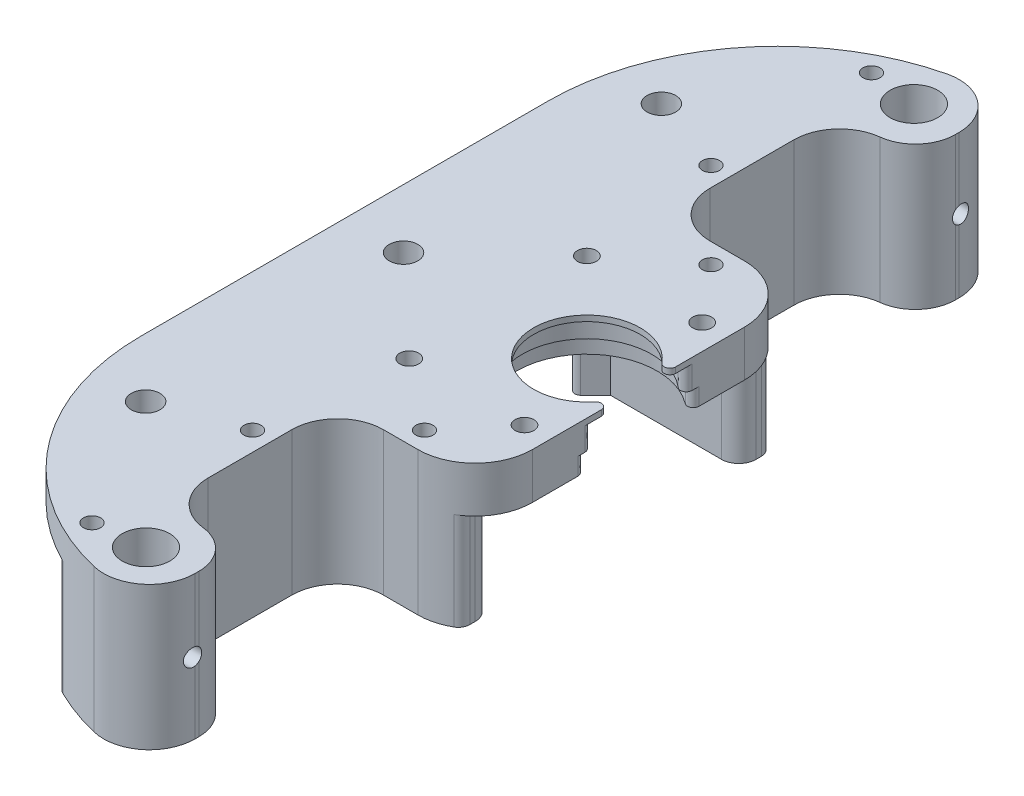
from build123d import *

# Parameters (mm, degrees)
SZKIC2_R                        = 1.65
SZKIC2_R_2                      = 11.3
SZKIC2_W                        = 13.3
SZKIC2_H                        = 7
SZKIC2_R_3                      = 1.5
SZKIC2_W_2                      = 6.7
SZKIC2_R_4                      = 4.15
SZKIC2_R_5                      = 2.5
DODANIE_WYCI_GNI_CIE1_DEPTH     = 5
DODANIE_WYCI_GNI_CIE2_START     = -20
SZKIC2_3_R                      = 1.5
DODANIE_WYCI_GNI_CIE2_DEPTH     = 20
ZAOKR_GLENIE1_R                 = 7
SZKIC3_R                        = 4.15
DODANIE_WYCI_GNI_CIE3_DEPTH     = 20
ZAOKR_GLENIE2_R                 = 3
ZAOKR_GLENIE3_R                 = 10
WYTNIJ_WYCI_GNI_CIE1_DEPTH      = 146.394986561
ZAOKR_GLENIE4_R                 = 15
ZAOKR_GLENIE5_R                 = 1
ZAOKR_GLENIE6_R                 = 40
ZAOKR_GLENIE7_R                 = 3
ZAOKR_GLENIE10_R                = 8
ZAOKR_GLENIE11_R                = 8
DODANIE_WYCI_GNI_CIE4_START     = -1
SZKIC6_R                        = 11.3
SZKIC6_R_2                      = 9.3
DODANIE_WYCI_GNI_CIE4_DEPTH     = 1
SZKIC7_R                        = 12.25
SZKIC7_R_2                      = 1.65
DODANIE_WYCI_GNI_CIE5_DEPTH     = 3
WYTNIJ_WYCI_GNI_CIE4_REACH      = 120.613
WYTNIJ_WYCI_GNI_CIE4_END_RADIUS = 4.15
SZKIC9_R                        = 1.5
WYTNIJ_WYCI_GNI_CIE5_REACH      = 120.613
WYTNIJ_WYCI_GNI_CIE5_END_RADIUS = 4.15
SZKIC9_3_R                      = 1.5
SZKIC10_W                       = 38.080641696
SZKIC10_H                       = 104.696958421
WYTNIJ_WYCI_GNI_CIE6_DEPTH      = 146.901949605
ZAOKR_GLENIE12_R                = 1
ZAOKR_GLENIE13_R                = 1
ZAOKR_GLENIE14_R                = 10
ZAOKR_GLENIE15_R                = 2


with BuildPart() as part:
    # Szkic2 → Dodanie-wyciągnięcie1 (new body)
    # profile 1 of 14: a face of its own
    with BuildSketch(Plane(origin=(0, 0, 0), x_dir=(1, 0, 0), z_dir=(0, 1, 0))):
        Polygon((-68.051313495, 13.491175162), (-65.66044053, 13.491175162), (-52.36044053, 13.491175162), (-45.66044053, 13.491175162), (-33.269567565, 13.491175162), (-29.16044053, 13.491175162), (-29.16044053, 17.600302197), (-29.16044053, 52.382048128), (-29.16044053, 56.491175162), (-33.269567565, 56.491175162), (-45.66044053, 56.491175162), (-52.36044053, 56.491175162), (-65.66044053, 56.491175162), (-68.051313495, 56.491175162), (-72.36044053, 52.182048128), (-72.36044053, 17.800302197), align=None)
        with Locations(Location((-66.16044053, 19.491175162, 0), (0, 0, 270))):
            Circle(SZKIC2_R, mode=Mode.SUBTRACT)
        with Locations(Location((-46.051180357, 19.491175162, 0), (0, 0, 270))):
            Circle(SZKIC2_R, mode=Mode.SUBTRACT)
        with Locations(Location((-50.66044053, 34.991175162, 0), (0, 0, 270))):
            Circle(SZKIC2_R_2, mode=Mode.SUBTRACT)
        with Locations(Location((-35.16044053, 19.491175162, 0), (0, 0, 270))):
            Circle(SZKIC2_R, mode=Mode.SUBTRACT)
        with Locations(Location((-66.16044053, 50.491175162, 0), (0, 0, 270))):
            Circle(SZKIC2_R, mode=Mode.SUBTRACT)
        with Locations(Location((-46.051180357, 50.491175162, 0), (0, 0, 270))):
            Circle(SZKIC2_R, mode=Mode.SUBTRACT)
        with Locations(Location((-35.16044053, 50.491175162, 0), (0, 0, 270))):
            Circle(SZKIC2_R, mode=Mode.SUBTRACT)
    # profile 2 of 14: a face of its own
    with BuildSketch(Plane(origin=(0, 0, 0), x_dir=(1, 0, 0), z_dir=(0, 1, 0))):
        with Locations((-59.01044053, 9.991175162)):
            Rectangle(SZKIC2_W, SZKIC2_H)
        with Locations(Location((-54.01044053, 9.991175162, 0), (0, 0, 270))):
            Circle(SZKIC2_R_3, mode=Mode.SUBTRACT)
    # profile 3 of 14: a face of its own
    with BuildSketch(Plane(origin=(0, 0, 0), x_dir=(1, 0, 0), z_dir=(0, 1, 0))):
        Polygon((-65.66044053, 6.491175162), (-65.66044053, 13.491175162), (-68.051313495, 13.491175162), (-72.36044053, 17.800302197), (-72.36044053, -11.508824838), (-72.36044053, -40.008824838), (-65.66044053, -40.008824838), (-65.66044053, -11.508824838), align=None)
        with Locations(Location((-69.01044053, -33.008824838, 0), (0, 0, 270))):
            Circle(SZKIC2_R_3, mode=Mode.SUBTRACT)
        with Locations(Location((-69.01044053, -5.008824838, 0), (0, 0, 270))):
            Circle(SZKIC2_R_3, mode=Mode.SUBTRACT)
    # profile 4 of 14: a face of its own
    with BuildSketch(Plane(origin=(0, 0, 0), x_dir=(1, 0, 0), z_dir=(0, 1, 0))):
        with Locations((-49.01044053, 9.991175162)):
            Rectangle(SZKIC2_W_2, SZKIC2_H)
    # profile 5 of 14: a face of its own
    with BuildSketch(Plane(origin=(0, 0, 0), x_dir=(1, 0, 0), z_dir=(0, 1, 0))):
        Polygon((-52.36044053, 6.491175162), (-65.66044053, 6.491175162), (-65.66044053, -11.508824838), (-52.36044053, -1.243587456), align=None)
    # profile 6 of 14: a face of its own
    with BuildSketch(Plane(origin=(0, 0, 0), x_dir=(1, 0, 0), z_dir=(0, 1, 0))):
        Polygon((-33.269567565, 13.491175162), (-45.66044053, 13.491175162), (-45.66044053, 6.491175162), (-52.36044053, 6.491175162), (-52.36044053, -1.243587456), align=None)
    # profile 7 of 14: a face of its own
    with BuildSketch(Plane(origin=(0, 0, 0), x_dir=(1, 0, 0), z_dir=(0, 1, 0))):
        Polygon((-52.36044053, -1.243587456), (-65.66044053, -11.508824838), (-65.66044053, -40.008824838), (-52.36044053, -40.008824838), align=None)
        with Locations(Location((-60.594472333, -32.008824838, 0), (0, 0, 270))):
            Circle(SZKIC2_R_4, mode=Mode.SUBTRACT)
    # profile 8 of 14: a face of its own
    with BuildSketch(Plane(origin=(0, 0, 0), x_dir=(1, 0, 0), z_dir=(0, 1, 0))):
        Polygon((-72.36044053, -11.508824838), (-72.36044053, 17.800302197), (-72.36044053, 52.182048128), (-72.36044053, 81.491175162), (-72.36044053, 109.991175162), (-92.96044053, 109.991175162), (-92.96044053, 81.491175162), (-92.96044053, -11.508824838), (-92.96044053, -40.008824838), (-72.36044053, -40.008824838), align=None)
        with Locations(Location((-82.66044053, -10.008824838, 0), (0, 0, 270))):
            Circle(SZKIC2_R_5, mode=Mode.SUBTRACT)
        with Locations(Location((-82.66044053, 34.991175162, 0), (0, 0, 270))):
            Circle(SZKIC2_R_5, mode=Mode.SUBTRACT)
        with Locations(Location((-82.66044053, 79.991175162, 0), (0, 0, 270))):
            Circle(SZKIC2_R_5, mode=Mode.SUBTRACT)
    # profile 9 of 14: a face of its own
    with BuildSketch(Plane(origin=(0, 0, 0), x_dir=(1, 0, 0), z_dir=(0, 1, 0))):
        Polygon((-72.36044053, 81.491175162), (-72.36044053, 52.182048128), (-68.051313495, 56.491175162), (-65.66044053, 56.491175162), (-65.66044053, 63.491175162), (-65.66044053, 81.491175162), (-65.66044053, 109.991175162), (-72.36044053, 109.991175162), align=None)
        with Locations(Location((-69.01044053, 74.991175162, 0), (0, 0, 270))):
            Circle(SZKIC2_R_3, mode=Mode.SUBTRACT)
        with Locations(Location((-69.01044053, 102.991175162, 0), (0, 0, 270))):
            Circle(SZKIC2_R_3, mode=Mode.SUBTRACT)
    # profile 10 of 14: a face of its own
    with BuildSketch(Plane(origin=(0, 0, 0), x_dir=(1, 0, 0), z_dir=(0, 1, 0))):
        with Locations((-59.01044053, 59.991175162)):
            Rectangle(SZKIC2_W, SZKIC2_H)
        with Locations(Location((-54.01044053, 59.991175162, 0), (0, 0, 270))):
            Circle(SZKIC2_R_3, mode=Mode.SUBTRACT)
    # profile 11 of 14: a face of its own
    with BuildSketch(Plane(origin=(0, 0, 0), x_dir=(1, 0, 0), z_dir=(0, 1, 0))):
        with Locations((-49.01044053, 59.991175162)):
            Rectangle(SZKIC2_W_2, SZKIC2_H)
    # profile 12 of 14: a face of its own
    with BuildSketch(Plane(origin=(0, 0, 0), x_dir=(1, 0, 0), z_dir=(0, 1, 0))):
        Polygon((-65.66044053, 81.491175162), (-65.66044053, 63.491175162), (-52.36044053, 63.491175162), (-52.36044053, 71.22593778), align=None)
    # profile 13 of 14: a face of its own
    with BuildSketch(Plane(origin=(0, 0, 0), x_dir=(1, 0, 0), z_dir=(0, 1, 0))):
        Polygon((-52.36044053, 109.991175162), (-65.66044053, 109.991175162), (-65.66044053, 81.491175162), (-52.36044053, 71.22593778), align=None)
        with Locations(Location((-60.594472333, 101.991175162, 0), (0, 0, 270))):
            Circle(SZKIC2_R_4, mode=Mode.SUBTRACT)
    # profile 14 of 14: a face of its own
    with BuildSketch(Plane(origin=(0, 0, 0), x_dir=(1, 0, 0), z_dir=(0, 1, 0))):
        Polygon((-45.66044053, 63.491175162), (-45.66044053, 56.491175162), (-33.269567565, 56.491175162), (-52.36044053, 71.22593778), (-52.36044053, 63.491175162), align=None)
    extrude(amount=DODANIE_WYCI_GNI_CIE1_DEPTH)

    # Szkic2<3> → Dodanie-wyciągnięcie2 (add)
    # profile 1 of 2: a face of its own
    with BuildSketch(Plane(origin=(0, 0, 0), x_dir=(1, 0, 0), z_dir=(0, 1, 0)).offset(DODANIE_WYCI_GNI_CIE2_START)):
        Polygon((-68.051313495, 13.491175162), (-72.36044053, 17.800302197), (-72.36044053, -40.008824838), (-65.66044053, -40.008824838), (-65.66044053, 6.491175162), (-45.66044053, 6.491175162), (-45.66044053, 13.491175162), align=None)
        with Locations(Location((-54.01044053, 9.991175162, 0), (0, 0, 270))):
            Circle(SZKIC2_3_R, mode=Mode.SUBTRACT)
        with Locations(Location((-69.01044053, -5.008824838, 0), (0, 0, 270))):
            Circle(SZKIC2_3_R, mode=Mode.SUBTRACT)
        with Locations(Location((-69.01044053, -33.008824838, 0), (0, 0, 270))):
            Circle(SZKIC2_3_R, mode=Mode.SUBTRACT)
    # profile 2 of 2: a face of its own
    with BuildSketch(Plane(origin=(0, 0, 0), x_dir=(1, 0, 0), z_dir=(0, 1, 0)).offset(DODANIE_WYCI_GNI_CIE2_START)):
        Polygon((-72.36044053, 109.991175162), (-72.36044053, 52.182048128), (-68.051313495, 56.491175162), (-45.66044053, 56.491175162), (-45.66044053, 63.491175162), (-65.66044053, 63.491175162), (-65.66044053, 109.991175162), align=None)
        with Locations(Location((-69.01044053, 74.991175162, 0), (0, 0, 270))):
            Circle(SZKIC2_3_R, mode=Mode.SUBTRACT)
        with Locations(Location((-69.01044053, 102.991175162, 0), (0, 0, 270))):
            Circle(SZKIC2_3_R, mode=Mode.SUBTRACT)
        with Locations(Location((-54.01044053, 59.991175162, 0), (0, 0, 270))):
            Circle(SZKIC2_3_R, mode=Mode.SUBTRACT)
    extrude(amount=DODANIE_WYCI_GNI_CIE2_DEPTH)

    # Zaokrąglenie1
    zaokr_glenie1_edges = [part.edges().sort_by_distance(p)[0] for p in [
        (-52.36044053, 2.5, 40.008824838),
        (-52.36044053, 2.5, -109.991175162),
    ]]
    fillet(zaokr_glenie1_edges, radius=ZAOKR_GLENIE1_R)

    # Szkic3 → Dodanie-wyciągnięcie3 (add)
    # profile 1 of 2: a face of its own
    with BuildSketch(Plane.XZ):
        with BuildLine():
            Line((-65.66044053, -109.991175162), (-59.36044053, -109.991175162))
            ThreePointArc((-59.36044053, -109.991175162), (-54.410693062, -107.940922631), (-52.36044053, -102.991175162))
            Line((-52.36044053, -102.991175162), (-52.36044053, -100.991175162))
            ThreePointArc((-52.36044053, -100.991175162), (-54.410693062, -96.041427694), (-59.36044053, -93.991175162))
            Line((-59.36044053, -93.991175162), (-65.66044053, -93.991175162))
            Line((-65.66044053, -93.991175162), (-65.66044053, -109.991175162))
        make_face()
        with Locations(Location((-60.594472333, -101.991175162, 0), (0, 0, 90))):
            Circle(SZKIC3_R, mode=Mode.SUBTRACT)
    # profile 2 of 2: a face of its own
    with BuildSketch(Plane.XZ):
        with BuildLine():
            Line((-65.66044053, 40.008824838), (-59.36044053, 40.008824838))
            ThreePointArc((-59.36044053, 40.008824838), (-54.410693062, 37.958572306), (-52.36044053, 33.008824838))
            Line((-52.36044053, 33.008824838), (-52.36044053, 31.008824838))
            ThreePointArc((-52.36044053, 31.008824838), (-54.410693062, 26.059077369), (-59.36044053, 24.008824838))
            Line((-59.36044053, 24.008824838), (-65.66044053, 24.008824838))
            Line((-65.66044053, 24.008824838), (-65.66044053, 40.008824838))
        make_face()
        with Locations(Location((-60.594472333, 32.008824838, 0), (0, 0, 90))):
            Circle(SZKIC3_R, mode=Mode.SUBTRACT)
    extrude(amount=DODANIE_WYCI_GNI_CIE3_DEPTH)

    # Zaokrąglenie2
    zaokr_glenie2_edges = [part.edges().sort_by_distance(p)[0] for p in [
        (-45.66044053, -10, -63.491175162),
        (-45.66044053, -10, -56.491175162),
        (-45.66044053, -10, -13.491175162),
        (-45.66044053, -10, -6.491175162),
    ]]
    fillet(zaokr_glenie2_edges, radius=ZAOKR_GLENIE2_R)

    # Zaokrąglenie3
    zaokr_glenie3_edges = [part.edges().sort_by_distance(p)[0] for p in [
        (-33.269567565, 2.5, -56.491175162),
        (-33.269567565, 2.5, -13.491175162),
    ]]
    fillet(zaokr_glenie3_edges, radius=ZAOKR_GLENIE3_R)

    # Szkic4 → Wytnij-wyciągnięcie1 (cut, through all)
    with BuildSketch(Plane.XZ):
        with BuildLine():
            Line((-52.36044053, 31.008824838), (-52.36044053, 1.243587456))
            Line((-52.36044053, 1.243587456), (-42.339011995, -6.491175162))
            Line((-42.339011995, -6.491175162), (-48.66044053, -6.491175162))
            Line((-48.66044053, -6.491175162), (-65.66044053, -6.491175162))
            Line((-65.66044053, -6.491175162), (-65.66044053, 24.008824838))
            Line((-65.66044053, 24.008824838), (-59.36044053, 24.008824838))
            ThreePointArc((-59.36044053, 24.008824838), (-54.410693062, 26.059077369), (-52.36044053, 31.008824838))
        make_face()
        with BuildLine():
            Line((-52.36044053, -71.22593778), (-52.36044053, -100.991175162))
            ThreePointArc((-52.36044053, -100.991175162), (-54.410693062, -96.041427694), (-59.36044053, -93.991175162))
            Line((-59.36044053, -93.991175162), (-65.66044053, -93.991175162))
            Line((-65.66044053, -93.991175162), (-65.66044053, -63.491175162))
            Line((-65.66044053, -63.491175162), (-48.66044053, -63.491175162))
            Line((-48.66044053, -63.491175162), (-42.339011995, -63.491175162))
            Line((-42.339011995, -63.491175162), (-52.36044053, -71.22593778))
        make_face()
    extrude(amount=-WYTNIJ_WYCI_GNI_CIE1_DEPTH, mode=Mode.SUBTRACT)

    # Zaokrąglenie4
    zaokr_glenie4_edges = [part.edges().sort_by_distance(p)[0] for p in [
        (-29.16044053, 2.5, -56.491175162),
        (-29.16044053, 2.5, -13.491175162),
        (-42.339011995, 2.5, -63.491175162),
        (-42.339011995, 2.5, -6.491175162),
    ]]
    fillet(zaokr_glenie4_edges, radius=ZAOKR_GLENIE4_R)

    # Zaokrąglenie5
    zaokr_glenie5_edges = [part.edges().sort_by_distance(p)[0] for p in [
        (-72.36044053, -10, -52.182048128),
        (-72.36044053, -10, -17.800302197),
    ]]
    fillet(zaokr_glenie5_edges, radius=ZAOKR_GLENIE5_R)

    # Zaokrąglenie6
    # the kernel refuses this fillet: 40 mm, written as the material it takes off along each edge
    with BuildSketch(Plane(origin=(-92.96044053, -98.711701434, -109.991175162), x_dir=(0, 0, 1), z_dir=(0, 1, 0))) as zaokr_glenie6_piece_1:
        with BuildLine():
            CenterArc((39.484680574, 40), ZAOKR_GLENIE6_R, 189.206896221, 80.793103779)
            Line((0, 33.6), (0, 0))
            Line((0, 0), (39.484680574, 0))
        make_face()
    extrude(amount=202.423402868, mode=Mode.SUBTRACT)
    with BuildSketch(Plane(origin=(-92.96044053, -98.711701434, 40.008824838), x_dir=(1, 0, 0), z_dir=(0, 1, 0))) as zaokr_glenie6_piece_2:
        with BuildLine():
            CenterArc((40, 39.484680574), ZAOKR_GLENIE6_R, 180, 80.793103779)
            Line((0, 39.484680574), (0, 0))
            Line((0, 0), (33.6, 0))
        make_face()
    extrude(amount=202.423402868, mode=Mode.SUBTRACT)

    # Zaokrąglenie7
    zaokr_glenie7_edges = [part.edges().sort_by_distance(p)[0] for p in [
        (-72.36044053, -10, -105.487060622),
        (-72.36044053, -10, 35.504710297),
    ]]
    fillet(zaokr_glenie7_edges, radius=ZAOKR_GLENIE7_R)

    # Zaokrąglenie10
    zaokr_glenie10_edges = [part.edges().sort_by_distance(p)[0] for p in [
        (-59.36044053, -7.5, -109.991175162),
        (-59.36044053, -7.5, 40.008824838),
    ]]
    fillet(zaokr_glenie10_edges, radius=ZAOKR_GLENIE10_R)

    # Zaokrąglenie11
    zaokr_glenie11_edges = [part.edges().sort_by_distance(p)[0] for p in [
        (-65.66044053, -7.5, 24.008824838),
        (-65.66044053, -7.5, -93.991175162),
        (-65.66044053, -7.5, -63.491175162),
        (-65.66044053, -7.5, -6.491175162),
    ]]
    fillet(zaokr_glenie11_edges, radius=ZAOKR_GLENIE11_R)

    # Szkic6 → Dodanie-wyciągnięcie4 (add)
    with BuildSketch(Plane(origin=(0, 5, 0), x_dir=(1, 0, 0), z_dir=(0, 1, 0)).offset(DODANIE_WYCI_GNI_CIE4_START)):
        with Locations(Location((-50.66044053, 34.991175162, 0), (0, 0, 270))):
            Circle(SZKIC6_R)
        with Locations(Location((-50.66044053, 34.991175162, 0), (0, 0, 270))):
            Circle(SZKIC6_R_2, mode=Mode.SUBTRACT)
    extrude(amount=DODANIE_WYCI_GNI_CIE4_DEPTH)

    # Szkic7 → Dodanie-wyciągnięcie5 (add)
    with BuildSketch(Plane.XZ):
        with BuildLine():
            Line((-72.36044053, -15.386088635), (-72.36044053, -54.59626169))
            ThreePointArc((-72.36044053, -54.59626169), (-71.743123963, -53.672382157), (-70.653333749, -53.889154909))
            Line((-70.653333749, -53.889154909), (-68.051313495, -56.491175162))
            Line((-68.051313495, -56.491175162), (-48.66044053, -56.491175162))
            ThreePointArc((-48.66044053, -56.491175162), (-46.539120187, -57.369854819), (-45.66044053, -59.491175162))
            Line((-45.66044053, -59.491175162), (-45.66044053, -60.491175162))
            ThreePointArc((-45.66044053, -60.491175162), (-46.539120187, -62.612495506), (-48.66044053, -63.491175162))
            Line((-48.66044053, -63.491175162), (-47.454451852, -63.491175162))
            ThreePointArc((-47.454451852, -63.491175162), (-42.612813728, -62.688306572), (-38.289468826, -60.365647199))
            Line((-38.289468826, -60.365647199), (-35.969263011, -58.574860471))
            ThreePointArc((-35.969263011, -58.574860471), (-35.776228908, -58.429559413), (-35.579740808, -58.288964287))
            ThreePointArc((-35.579740808, -58.288964287), (-30.861747064, -52.924289923), (-29.16044053, -45.985647975))
            Line((-29.16044053, -45.985647975), (-29.16044053, -23.99670235))
            ThreePointArc((-29.16044053, -23.99670235), (-30.861747064, -17.058060401), (-35.579740808, -11.693386037))
            ThreePointArc((-35.579740808, -11.693386037), (-35.776228908, -11.552790912), (-35.969263011, -11.407489853))
            Line((-35.969263011, -11.407489853), (-38.289468826, -9.616703126))
            ThreePointArc((-38.289468826, -9.616703126), (-42.612813728, -7.294043752), (-47.454451852, -6.491175162))
            Line((-47.454451852, -6.491175162), (-48.66044053, -6.491175162))
            ThreePointArc((-48.66044053, -6.491175162), (-46.539120187, -7.369854819), (-45.66044053, -9.491175162))
            Line((-45.66044053, -9.491175162), (-45.66044053, -10.491175162))
            ThreePointArc((-45.66044053, -10.491175162), (-46.539120187, -12.612495506), (-48.66044053, -13.491175162))
            Line((-48.66044053, -13.491175162), (-68.051313495, -13.491175162))
            Line((-68.051313495, -13.491175162), (-70.653333749, -16.093195416))
            ThreePointArc((-70.653333749, -16.093195416), (-71.743123963, -16.309968167), (-72.36044053, -15.386088635))
        make_face()
        with Locations(Location((-50.66044053, -34.991175162, 0), (0, 0, 270))):
            Circle(SZKIC7_R, mode=Mode.SUBTRACT)
        with Locations(Location((-66.16044053, -19.491175162, 0), (0, 0, 270))):
            Circle(SZKIC7_R_2, mode=Mode.SUBTRACT)
        with Locations(Location((-66.16044053, -50.491175162, 0), (0, 0, 270))):
            Circle(SZKIC7_R_2, mode=Mode.SUBTRACT)
        with Locations(Location((-35.16044053, -50.491175162, 0), (0, 0, 270))):
            Circle(SZKIC7_R_2, mode=Mode.SUBTRACT)
        with Locations(Location((-35.16044053, -19.491175162, 0), (0, 0, 270))):
            Circle(SZKIC7_R_2, mode=Mode.SUBTRACT)
        with Locations(Location((-46.051180357, -19.491175162, 0), (0, 0, 270))):
            Circle(SZKIC7_R_2, mode=Mode.SUBTRACT)
        with Locations(Location((-46.051180357, -50.491175162, 0), (0, 0, 270))):
            Circle(SZKIC7_R_2, mode=Mode.SUBTRACT)
    extrude(amount=DODANIE_WYCI_GNI_CIE5_DEPTH)

    # Wytnij-wyciągnięcie4: up to this cylinder (the profile starts outside it)
    wytnij_wyci_gni_cie4_end = Plane(origin=(-60.594472333, -7.5, 32.008824838), z_dir=(0, -1, 0)) * Cylinder(WYTNIJ_WYCI_GNI_CIE4_END_RADIUS, 250.526, mode=Mode.PRIVATE)
    # Szkic9 → Wytnij-wyciągnięcie4 (cut, up to the surface)
    with BuildSketch(Plane(origin=(-52.36044053, 0, 0), x_dir=(0, 0, -1), z_dir=(1, 0, 0)), mode=Mode.PRIVATE) as wytnij_wyci_gni_cie4_sk1:
        with Locations((-32.008824838, -7.5)):
            Circle(SZKIC9_R)
    wytnij_wyci_gni_cie4_tool1 = extrude(wytnij_wyci_gni_cie4_sk1.sketch, amount=-WYTNIJ_WYCI_GNI_CIE4_REACH, mode=Mode.PRIVATE) - wytnij_wyci_gni_cie4_end
    add(wytnij_wyci_gni_cie4_tool1.solids().sort_by_distance((-52.360441, -7.5, 32.008825))[0], mode=Mode.SUBTRACT)

    # Wytnij-wyciągnięcie5: up to this cylinder (the profile starts outside it)
    wytnij_wyci_gni_cie5_end = Plane(origin=(-60.594472333, -7.5, -101.991175162), z_dir=(0, -1, 0)) * Cylinder(WYTNIJ_WYCI_GNI_CIE5_END_RADIUS, 250.526, mode=Mode.PRIVATE)
    # Szkic9<3> → Wytnij-wyciągnięcie5 (cut, up to the surface)
    with BuildSketch(Plane(origin=(-52.36044053, 0, 0), x_dir=(0, 0, -1), z_dir=(1, 0, 0)), mode=Mode.PRIVATE) as wytnij_wyci_gni_cie5_sk1:
        with Locations((101.991175162, -7.5)):
            Circle(SZKIC9_3_R)
    wytnij_wyci_gni_cie5_tool1 = extrude(wytnij_wyci_gni_cie5_sk1.sketch, amount=-WYTNIJ_WYCI_GNI_CIE5_REACH, mode=Mode.PRIVATE) - wytnij_wyci_gni_cie5_end
    add(wytnij_wyci_gni_cie5_tool1.solids().sort_by_distance((-52.360441, -7.5, -101.991175))[0], mode=Mode.SUBTRACT)

    # Szkic10 → Wytnij-wyciągnięcie6 (cut, through all)
    with BuildSketch(Plane(origin=(0, 5, 0), x_dir=(1, 0, 0), z_dir=(0, 1, 0))):
        with Locations((-22.620119682, 21.339654373)):
            Rectangle(SZKIC10_W, SZKIC10_H)
    extrude(amount=-WYTNIJ_WYCI_GNI_CIE6_DEPTH, mode=Mode.SUBTRACT)

    # Zaokrąglenie12
    zaokr_glenie12_edges = [part.edges().sort_by_distance(p)[0] for p in [
        (-41.66044053, -1.5, -43.301560232),
        (-41.66044053, -1.5, -26.680790093),
        (-41.66044053, 4.5, -32.64810026),
        (-41.66044053, 4.5, -37.334250065),
    ]]
    fillet(zaokr_glenie12_edges, radius=ZAOKR_GLENIE12_R)

    # Zaokrąglenie13
    zaokr_glenie13_edges = [part.edges().sort_by_distance(p)[0] for p in [
        (-41.66044053, 2, -41.824183285),
        (-41.66044053, 2, -28.15816704),
    ]]
    fillet(zaokr_glenie13_edges, radius=ZAOKR_GLENIE13_R)

    # Zaokrąglenie14
    # the kernel refuses this fillet: 10 mm, written as the material it takes off along each edge
    with BuildSketch(Plane(origin=(-41.66044053, -28.168849255, -7.655372591), x_dir=(-0.9932913398871196, 0, 0.11563872234355921), z_dir=(0, 1, 0))) as zaokr_glenie14_piece_1:
        with BuildLine():
            CenterArc((8.911152479, -9.932913399), ZAOKR_GLENIE14_R, 83.359533064, 90)
            Line((-1.02176092, -8.776526175), (-2.01505226, -8.660887453))
            Line((-2.01505226, -8.660887453), (-0.99329134, 0.115638722))
            Line((-0.99329134, 0.115638722), (-0.277012449, 0.960866329))
            ThreePointArc((-0.277012449, 0.960866329), (6.005406295, 1.479666497), (10.183178424, 0.99329134))
            Line((10.183178424, 0.99329134), (10.067539702, 0))
        make_face()
    extrude(amount=58.33769851, mode=Mode.SUBTRACT)
    with BuildSketch(Plane(origin=(-41.66044053, -28.168849255, -62.326977734), x_dir=(-0.9932913398871193, 0, -0.11563872234356133), z_dir=(0, 1, 0))) as zaokr_glenie14_piece_2:
        with BuildLine():
            CenterArc((8.911152479, 9.932913399), ZAOKR_GLENIE14_R, 186.640466936, 90)
            Line((-1.02176092, 8.776526175), (-2.01505226, 8.660887453))
            Line((-2.01505226, 8.660887453), (-0.99329134, -0.115638722))
            Line((-0.99329134, -0.115638722), (-0.277012449, -0.960866329))
            ThreePointArc((-0.277012449, -0.960866329), (6.005406295, -1.479666497), (10.183178424, -0.99329134))
            Line((10.183178424, -0.99329134), (10.067539702, 0))
        make_face()
    extrude(amount=58.33769851, mode=Mode.SUBTRACT)

    # Zaokrąglenie15
    # the kernel refuses this fillet: 2 mm, written as the material it takes off along each edge
    with BuildSketch(Plane(origin=(-45.899675627, -23.171295205, -8.317217264), x_dir=(-0.8425696629314943, 0, 0.538587377411974), z_dir=(0, 1, 0))) as zaokr_glenie15_piece_1:
        with BuildLine():
            CenterArc((0.812619352, -1.997960843), ZAOKR_GLENIE15_R, 87.412472811, 60)
            Line((-0.872519974, -0.920786088), (-1.041033907, -0.813068612))
            ThreePointArc((-1.041033907, -0.813068612), (-1.002365073, -0.752574832), (-0.112923857, 0.165070296))
            Line((-0.112923857, 0.165070296), (-0.009029104, 0.199796084))
            ThreePointArc((-0.009029104, 0.199796084), (0.451455195, 0.210195787), (0.911939495, 0.199796084))
            Line((0.911939495, 0.199796084), (0.902910391, 0))
        make_face()
    extrude(amount=20.171295205, mode=Mode.SUBTRACT)
    with BuildSketch(Plane(origin=(-45.899675627, -23.171295205, -61.665133061), x_dir=(-0.8425696629314944, 0, -0.5385873774119737), z_dir=(0, 1, 0))) as zaokr_glenie15_piece_2:
        with BuildLine():
            CenterArc((0.812619352, 1.997960843), ZAOKR_GLENIE15_R, 212.587527189, 60)
            Line((-0.872519974, 0.920786088), (-1.041033907, 0.813068612))
            ThreePointArc((-1.041033907, 0.813068612), (-1.002365073, 0.752574832), (-0.112923857, -0.165070296))
            Line((-0.112923857, -0.165070296), (-0.009029104, -0.199796084))
            ThreePointArc((-0.009029104, -0.199796084), (0.451455195, -0.210195787), (0.911939495, -0.199796084))
            Line((0.911939495, -0.199796084), (0.902910391, 0))
        make_face()
    extrude(amount=20.171295205, mode=Mode.SUBTRACT)


solid = part.part
